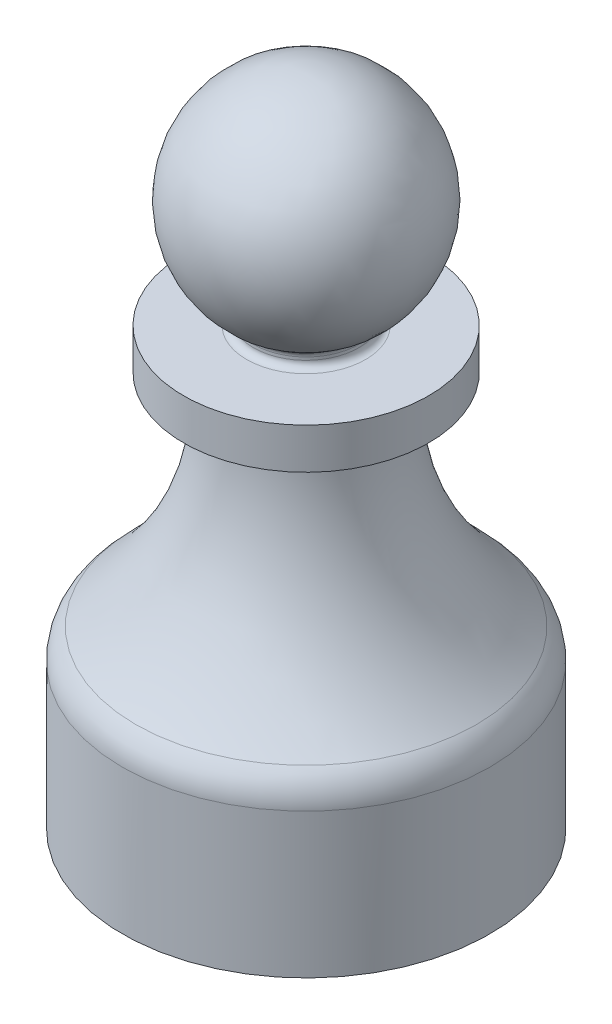
from build123d import *

# Parameters (mm, degrees)
CHAMFER1_SIZE = 2
FILLET1_R     = 3
FILLET2_R     = 0.5


with BuildPart() as part:
    # Sketch1 → Revolve1 (revolve)
    with BuildSketch(Plane.XY, mode=Mode.PRIVATE) as revolve1_sk:
        with BuildLine():
            Line((9.5, 13.045692134), (9.5, 0))
            Line((9.5, 0), (13.5, 0))
            Line((13.5, 0), (13.5, 12))
            ThreePointArc((13.5, 12), (7.655959241, 19.576158489), (6, 29))
            Line((6, 29), (9, 29))
            Line((9, 29), (9, 32))
            Line((9, 32), (3.872983346, 32))
            Line((3.872983346, 32), (3.872983346, 33))
            ThreePointArc((3.872983346, 33), (7.745966692, 42), (0, 48))
            Line((0, 48), (0, 40))
            Line((0, 40), (0, 37))
            Line((0, 37), (0, 34.783882181))
            Line((0, 34.783882181), (0, 32))
            Line((0, 32), (3.954315273, 27.64896262))
            ThreePointArc((3.954315273, 27.64896262), (5.387413027, 19.838550851), (9.5, 13.045692134))
        make_face()
    revolve(revolve1_sk.sketch.rotate(Axis((0, 37, 0), (0, 1, 0)), 90), axis=Axis((0, 37, 0), (0, 1, 0)))

    # Chamfer1
    # the kernel refuses this chamfer: 2, 1.204425644 mm, written as the material it adds along each edge
    with BuildSketch(Plane(origin=(0, 29, 0), x_dir=(0, 0, -1), z_dir=(1, 0, 0))) as chamfer1_piece_1:
        with BuildLine():
            Line((5.955041017, -1.180657619), (6 + CHAMFER1_SIZE, 0))
            Line((6 + CHAMFER1_SIZE, 0), (6, 0))
            ThreePointArc((6, 0), (5.968001768, -0.611258692), (5.955041017, -1.180657619))
        make_face()
    revolve(axis=Axis((0, 29, 0), (0, 1, 0)))

    # Fillet1
    fillet1_edges = [part.edges().sort_by_distance(p)[0] for p in [
        (0, 12, 13.5),
    ]]
    fillet(fillet1_edges, radius=FILLET1_R)

    # Fillet2
    fillet2_edges = [part.edges().sort_by_distance(p)[0] for p in [
        (0, 33, 3.872983346),
        (0, 32, 3.872983346),
    ]]
    fillet(fillet2_edges, radius=FILLET2_R)


solid = part.part
